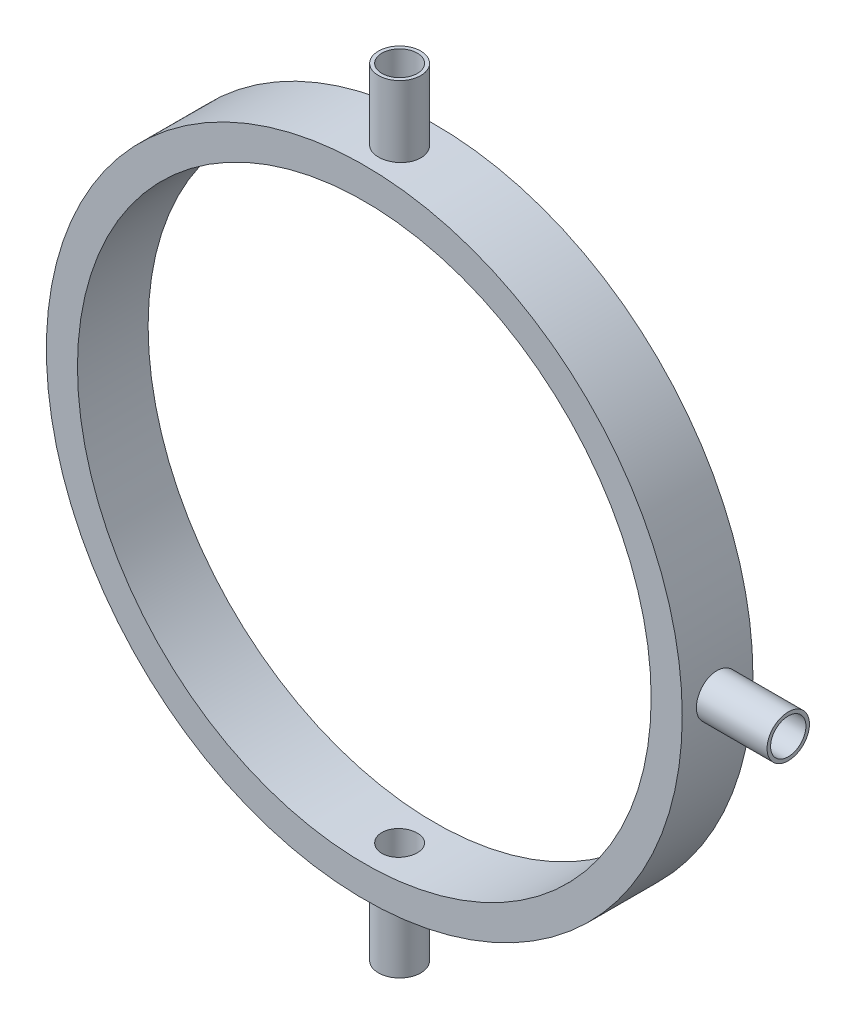
from build123d import *

# Parameters (mm, degrees)
SKETCH1_R           = 57.15
BOSS_EXTRUDE1_DEPTH = 6.35
SKETCH2_R           = 3.81
SKETCH2_R_2         = 3.175
BOSS_EXTRUDE2_DEPTH = 69.85
SKETCH3_R           = 3.81
SKETCH3_R_2         = 3.175
BOSS_EXTRUDE3_DEPTH = 69.85
SKETCH4_R           = 51.562
CUT_EXTRUDE1_DEPTH  = 100.595858501
SKETCH5_R           = 3.175
CUT_EXTRUDE2_DEPTH  = 157.318377177
CUT_EXTRUDE3_REACH  = 147.08
SKETCH6_R           = 3.175


with BuildPart() as part:
    # Sketch1 → Boss-Extrude1 (new, symmetric)
    with BuildSketch(Plane.XY):
        Circle(SKETCH1_R)
    extrude(amount=BOSS_EXTRUDE1_DEPTH, both=True)

    # Sketch2 → Boss-Extrude2 (add)
    with BuildSketch(Plane(origin=(0, 0, 0), x_dir=(0, 0, -1), z_dir=(1, 0, 0))):
        Circle(SKETCH2_R)
        Circle(SKETCH2_R_2, mode=Mode.SUBTRACT)
    extrude(amount=BOSS_EXTRUDE2_DEPTH)

    # Sketch3 → Boss-Extrude3 (add, symmetric)
    with BuildSketch(Plane(origin=(0, 0, 0), x_dir=(1, 0, 0), z_dir=(0, 1, 0))):
        Circle(SKETCH3_R)
        Circle(SKETCH3_R_2, mode=Mode.SUBTRACT)
    extrude(amount=BOSS_EXTRUDE3_DEPTH, both=True)

    # Sketch4 → Cut-Extrude1 (cut, through all)
    with BuildSketch(Plane.XY.offset(6.35)):
        Circle(SKETCH4_R)
    extrude(amount=-CUT_EXTRUDE1_DEPTH, mode=Mode.SUBTRACT)

    # Sketch5 → Cut-Extrude2 (cut, through all)
    with BuildSketch(Plane.XZ.offset(69.85)):
        Circle(SKETCH5_R)
    extrude(amount=-CUT_EXTRUDE2_DEPTH, mode=Mode.SUBTRACT)

    # Sketch6 → Cut-Extrude3 (cut, up to next)
    with BuildSketch(Plane(origin=(69.85, 0, 0), x_dir=(0, 0, -1), z_dir=(1, 0, 0)), mode=Mode.PRIVATE) as cut_extrude3_sk1:
        Circle(SKETCH6_R)
    cut_extrude3_tool1 = extrude(cut_extrude3_sk1.sketch, amount=-CUT_EXTRUDE3_REACH, mode=Mode.PRIVATE) & part.part
    add(cut_extrude3_tool1.solids().sort_by_distance((69.85, 0, 0))[0], mode=Mode.SUBTRACT)


solid = part.part
